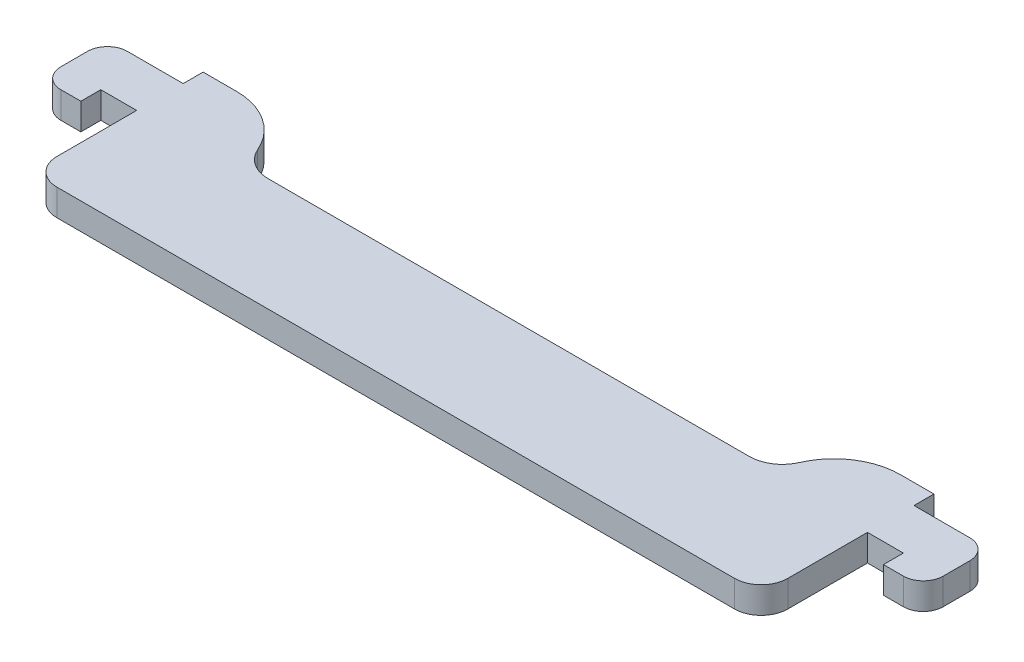
from build123d import *

# Parameters (mm, degrees)
ESTRUSIONE_ESTRUSIONE1_DEPTH = 4
RACCORDO1_R                  = 10
RACCORDO2_R                  = 4
RACCORDO9_R                  = 3
RACCORDO10_R                 = 3
RACCORDO11_R                 = 5


with BuildPart() as part:
    # Schizzo1 → Estrusione-Estrusione1 (new body)
    with BuildSketch(Plane(origin=(0, 0, 0), x_dir=(1, 0, 0), z_dir=(0, 1, 0))):
        Polygon((-11.4, 23), (-11.4, 13), (-5.4, 13), (-5.4, 16), (0, 16), (0, 0), (110, 0), (110, 16), (115.4, 16), (115.4, 13), (121.4, 13), (121.4, 23), (110, 23), (110, 26), (95, 26), (95, 17), (15, 17), (15, 26), (0, 26), (0, 23), align=None)
    extrude(amount=ESTRUSIONE_ESTRUSIONE1_DEPTH)

    # Raccordo1
    # the kernel refuses this fillet: 10 mm, written as the material it takes off along each edge
    with BuildSketch(Plane(origin=(95, -24.874685928, -26), x_dir=(1, 0, 0), z_dir=(0, 1, 0))) as raccordo1_piece_1:
        with BuildLine():
            CenterArc((9.949874371, -10), RACCORDO1_R, 90, 84.260829523)
            Line((0, -9), (-0.198997487, -8.98))
            ThreePointArc((-0.198997487, -8.98), (-0.2, -4.5), (-0.2, 0))
            Line((-0.2, 0), (0, 0.2))
            Line((0, 0.2), (9.949874371, 0.2))
            Line((9.949874371, 0.2), (9.949874371, 0))
        make_face()
    extrude(amount=53.749371855, mode=Mode.SUBTRACT)
    with BuildSketch(Plane(origin=(15, -24.874685928, -26), x_dir=(0, 0, 1), z_dir=(0, 1, 0))) as raccordo1_piece_2:
        with BuildLine():
            CenterArc((10, -9.949874371), RACCORDO1_R, 95.739170477, 84.260829523)
            Line((0, -9.949874371), (-0.2, -9.949874371))
            Line((-0.2, -9.949874371), (-0.2, 0))
            Line((-0.2, 0), (0, 0.2))
            ThreePointArc((0, 0.2), (4.5, 0.2), (8.98, 0.198997487))
            Line((8.98, 0.198997487), (9, 0))
        make_face()
    extrude(amount=53.749371855, mode=Mode.SUBTRACT)

    # Raccordo2
    raccordo2_edges = [part.edges().sort_by_distance(p)[0] for p in [
        (110, 2, 0),
        (0, 2, 0),
    ]]
    fillet(raccordo2_edges, radius=RACCORDO2_R)

    # Raccordo9
    raccordo9_edges = [part.edges().sort_by_distance(p)[0] for p in [
        (-11.4, 2, -13),
        (-11.4, 2, -23),
    ]]
    fillet(raccordo9_edges, radius=RACCORDO9_R)

    # Raccordo10
    raccordo10_edges = [part.edges().sort_by_distance(p)[0] for p in [
        (121.4, 2, -23),
        (121.4, 2, -13),
    ]]
    fillet(raccordo10_edges, radius=RACCORDO10_R)

    # Raccordo11
    raccordo11_edges = [part.edges().sort_by_distance(p)[0] for p in [
        (15, 2, -17),
        (95, 2, -17),
    ]]
    fillet(raccordo11_edges, radius=RACCORDO11_R)


solid = part.part
